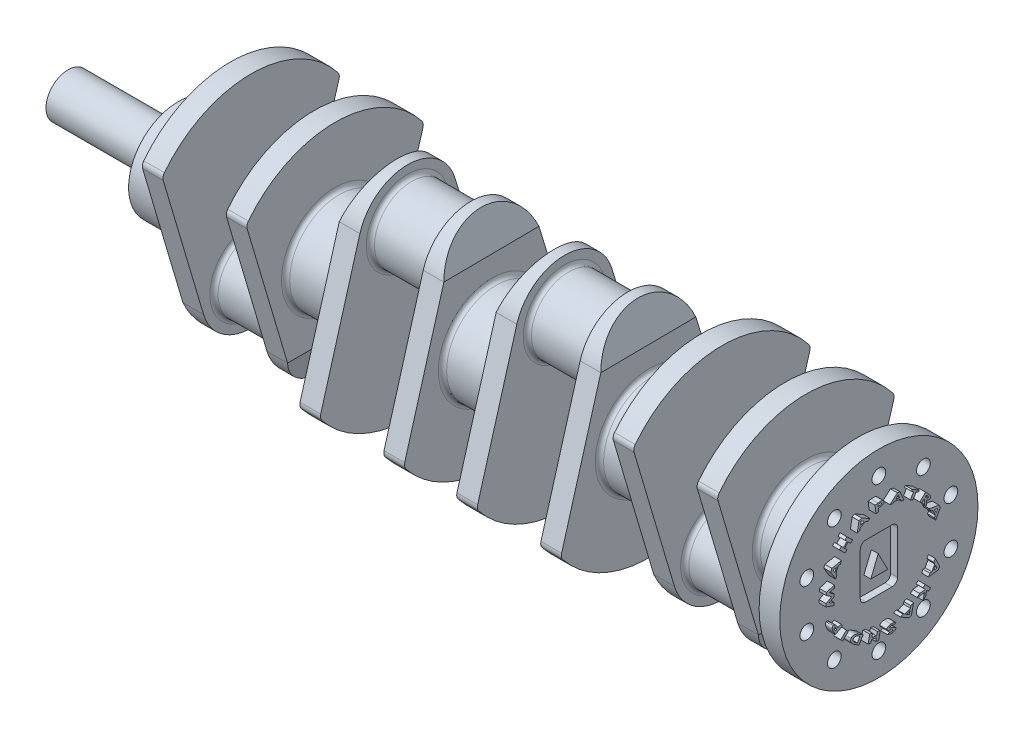
from build123d import *

# Parameters (mm, degrees)
SKETCH1_R               = 36
BOSS_EXTRUDE1_DEPTH     = 38
SKETCH3_R               = 27
BOSS_EXTRUDE2_DEPTH     = 15
SKETCH3_2_R             = 27
BOSS_EXTRUDE3_DEPTH     = 61
CUT_EXTRUDE1_DEPTH      = 143.724458813
CUT_EXTRUDE1_DEPTH_BACK = 143.724458813
BODY_MOVE_COPY1_ANGLE   = 179.5
BOSS_EXTRUDE4_START     = 15
SKETCH5_R               = 72
SKETCH5_R_2             = 5
SKETCH5_R_3             = 36
BOSS_EXTRUDE4_DEPTH     = 15
SKETCH6_R               = 16
BOSS_EXTRUDE5_DEPTH     = 80
FILLET1_R               = 3
FILLET2_R               = 5
WRAP1_DEPTH             = 5
WRAP2_START             = -5
WRAP2_DEPTH             = 5


# Read off the part's stored shape, not the designer's step: Wrap1, Wrap2
with BuildPart() as part:
    # Sketch1 → Boss-Extrude1 (new body)
    with BuildSketch(Plane(origin=(0, 0, 0), x_dir=(0, 0, -1), z_dir=(1, 0, 0))):
        Circle(SKETCH1_R)
    extrude(amount=BOSS_EXTRUDE1_DEPTH)

    # Sketch3 → Boss-Extrude2 (add)
    with BuildSketch(Plane(origin=(38, 0, 0), x_dir=(0, 0, -1), z_dir=(1, 0, 0))):
        with BuildLine():
            Line((-34.517510455, -54.224552409), (-64.569893475, 47.23059238))
            ThreePointArc((-64.569893475, 47.23059238), (0, 80), (64.569893475, 47.23059238))
            Line((64.569893475, 47.23059238), (34.517510455, -54.224552409))
            ThreePointArc((34.517510455, -54.224552409), (0, -80), (-34.517510455, -54.224552409))
        make_face()
        with Locations(Location((0, -44, 0), (0, 0, 144.817798311))):
            Circle(SKETCH3_R, mode=Mode.SUBTRACT)
    extrude(amount=BOSS_EXTRUDE2_DEPTH)

    # Sketch3<2> → Boss-Extrude3 (add)
    with BuildSketch(Plane(origin=(38, 0, 0), x_dir=(0, 0, -1), z_dir=(1, 0, 0))):
        with Locations(Location((0, -44, 0), (0, 0, 180))):
            Circle(SKETCH3_2_R)
    extrude(amount=BOSS_EXTRUDE3_DEPTH)

    # Sketch4 → Cut-Extrude1 (cut, two sides: drawn at the far end of the back side and taken through both)
    with BuildSketch(Plane.XY.offset(-CUT_EXTRUDE1_DEPTH_BACK)):
        Polygon((38, -54.224552409), (45.5, -80), (38, -80), align=None)
    extrude(amount=CUT_EXTRUDE1_DEPTH + CUT_EXTRUDE1_DEPTH_BACK, mode=Mode.SUBTRACT)

    # Mirror3: part across plane


with BuildPart() as part_1:
    add(part.part)
    add(part.part.mirror(Plane(origin=(76, 0, 0), x_dir=(0, 0, 1), z_dir=(1, 0, 0))))


with BuildPart() as body_2:
    # Mirror4: mirrored copy
    add(part_1.part.mirror(Plane(origin=(133, 0, 0), x_dir=(0, 0, 1), z_dir=(1, 0, 0))))


with BuildPart() as body_2_1:
    # Body-Move/Copy1: moved
    add(body_2.part.rotate(Axis((0, 0, 0), (-1, 0, 0)), BODY_MOVE_COPY1_ANGLE))


with BuildPart() as part_2:
    add(part_1.part)

    # Combine1: union body 2
    add(body_2_1.part)

    # Mirror5: part across plane


with BuildPart() as part_3:
    add(part_2.part)
    add(part_2.part.mirror(Plane(origin=(247, 0, 0), x_dir=(0, 0, 1), z_dir=(1, 0, 0))))

    # Sketch5 → Boss-Extrude4 (add)
    # profile 1 of 2: a face of its own
    with BuildSketch(Plane(origin=(494, 0, 0), x_dir=(0, 0, -1), z_dir=(1, 0, 0)).offset(BOSS_EXTRUDE4_START)):
        Circle(SKETCH5_R)
        with Locations((-32.328188876, 44.495934691)):
            Circle(SKETCH5_R_2, mode=Mode.SUBTRACT)
        with Locations((-52.308108396, 16.995934691)):
            Circle(SKETCH5_R_2, mode=Mode.SUBTRACT)
        with Locations((-52.308108396, -16.995934691)):
            Circle(SKETCH5_R_2, mode=Mode.SUBTRACT)
        with Locations((-32.328188876, -44.495934691)):
            Circle(SKETCH5_R_2, mode=Mode.SUBTRACT)
        with Locations((0, -55)):
            Circle(SKETCH5_R_2, mode=Mode.SUBTRACT)
        with Locations((32.328188876, -44.495934691)):
            Circle(SKETCH5_R_2, mode=Mode.SUBTRACT)
        with Locations((52.308108396, -16.995934691)):
            Circle(SKETCH5_R_2, mode=Mode.SUBTRACT)
        with Locations((52.308108396, 16.995934691)):
            Circle(SKETCH5_R_2, mode=Mode.SUBTRACT)
        with Locations((32.328188876, 44.495934691)):
            Circle(SKETCH5_R_2, mode=Mode.SUBTRACT)
        with Locations((0, 55)):
            Circle(SKETCH5_R_2, mode=Mode.SUBTRACT)
        Circle(SKETCH5_R_3, mode=Mode.SUBTRACT)
    # profile 2 of 2: a face of its own
    with BuildSketch(Plane(origin=(494, 0, 0), x_dir=(0, 0, -1), z_dir=(1, 0, 0)).offset(BOSS_EXTRUDE4_START)):
        Circle(SKETCH5_R_3)
    extrude(amount=-BOSS_EXTRUDE4_DEPTH)

    # Sketch6 → Boss-Extrude5 (add)
    with BuildSketch(Plane.ZY):
        Circle(SKETCH6_R)
    extrude(amount=BOSS_EXTRUDE5_DEPTH)

    # Fillet1
    fillet1_edges = [part_3.edges().sort_by_distance(p)[0] for p in [
        (53, -44, -27),
        (456, 0, 36),
        (494, 0, 36),
        (441, -44, -27),
        (395, -44, -27),
        (342, 0, 36),
        (380, 0, 36),
        (281, 43.762708156, 27.382939485),
        (327, 43.762708156, 27.382939485),
        (0, 0, -16),
        (99, -44, -27),
        (38, 0, 36),
        (114, 0, 36),
        (152, 0, 36),
        (228, 0.314155278, -35.99862923),
        (266, 0.314155278, -35.99862923),
        (213, 43.762708156, 27.382939485),
        (167, 43.762708156, 27.382939485),
    ]]
    fillet(fillet1_edges, radius=FILLET1_R)

    # Fillet2
    fillet2_edges = [part_3.edges().sort_by_distance(p)[0] for p in [
        (45.5, 47.23059238, 64.569893475),
        (448.5, 47.23059238, -64.569893475),
        (448.5, 47.23059238, 64.569893475),
        (387.5, 47.23059238, -64.569893475),
        (387.5, 47.23059238, 64.569893475),
        (273.5, -47.792265452, 64.155275411),
        (273.5, -46.665322516, -64.979594293),
        (334.5, -47.792265452, 64.155275411),
        (334.5, -46.665322516, -64.979594293),
        (106.5, 47.23059238, -64.569893475),
        (106.5, 47.23059238, 64.569893475),
        (220.5, -47.792265452, 64.155275411),
        (220.5, -46.665322516, -64.979594293),
        (159.5, -47.792265452, 64.155275411),
        (159.5, -46.665322516, -64.979594293),
        (45.5, 47.23059238, -64.569893475),
    ]]
    fillet(fillet2_edges, radius=FILLET2_R)

    # Wrap1 outline → Wrap1 (add)
    # profile 1 of 17: a face of its own
    with BuildSketch(Plane(origin=(509, 0, 0), x_dir=(0, 0, -1), z_dir=(1, 0, 0))):
        with BuildLine():
            add(Edge.make_bspline(
                [(30.429145669, 31.278633196), (30.529714484, 31.175524895), (30.723586774, 30.97675709), (30.998471286, 30.685651702), (31.247338782, 30.41362089), (31.470231429, 30.161696818), (31.665061076, 29.927807723), (31.835209086, 29.715007837), (31.977848594, 29.52002756), (32.09739194, 29.341520557), (32.195364999, 29.171832525), (32.282688438, 29.009274234), (32.355863107, 28.847193799), (32.419966671, 28.687840548), (32.469403122, 28.528430808), (32.510142867, 28.371486623), (32.536172291, 28.215731032), (32.553469658, 28.063541172), (32.55684607, 27.91529612), (32.548408891, 27.773035329), (32.524589617, 27.637930635), (32.488880662, 27.509728828), (32.438023848, 27.389132553), (32.37520509, 27.275109299), (32.297221124, 27.16917764), (32.236800833, 27.105186363), (32.206178923, 27.072754623)],
                knots=[0, 0, 0, 0, 0.086183646, 0.166141174, 0.239561119, 0.306794224, 0.367392138, 0.421693658, 0.469793409, 0.511914684, 0.5501677, 0.58699646, 0.622277761, 0.656525956, 0.689699113, 0.722076818, 0.753468047, 0.784108508, 0.813653429, 0.842088185, 0.869235459, 0.895591144, 0.921549795, 0.947369509, 0.973326077, 1, 1, 1, 1], degree=3))
            Line((30.429145669, 31.278633196), (28.898145235, 32.836452373))
            Line((28.898145235, 32.836452373), (24.770390828, 28.78099197))
            Line((24.770390828, 28.78099197), (26.213938839, 27.311791248))
            Line((26.213938839, 27.311791248), (27.961821284, 29.029356853))
            Line((27.961821284, 29.029356853), (28.095915, 28.892931072))
            Line((28.095915, 28.892931072), (28.055103869, 25.439143345))
            Line((28.055103869, 25.439143345), (29.632745596, 23.833516843))
            Line((29.632745596, 23.833516843), (29.673556727, 27.46337545))
            add(Edge.make_bspline(
                [(32.206178923, 27.072754623), (32.171961657, 27.041121702), (32.104221329, 26.97849763), (31.990451903, 26.901801135), (31.869962485, 26.840696535), (31.743165908, 26.79307029), (31.608554693, 26.763003301), (31.466866723, 26.749837996), (31.318767717, 26.749263935), (31.163509451, 26.766904468), (31.001494792, 26.798121919), (30.832517724, 26.847024585), (30.656742721, 26.911613183), (30.473476864, 26.991243783), (30.283170427, 27.086515942), (30.08501184, 27.195703857), (29.880398297, 27.322481134), (29.743945745, 27.415428548), (29.673556727, 27.46337545)],
                knots=[0, 0, 0, 0, 0.050124638, 0.099232343, 0.14715377, 0.195359514, 0.244709218, 0.295187372, 0.348344958, 0.403905245, 0.463173033, 0.525841674, 0.593106823, 0.664720363, 0.740905851, 0.822215008, 0.908289653, 1, 1, 1, 1], degree=3))
        make_face()
        with BuildLine():
            add(Edge.make_bspline(
                [(29.182657121, 29.319698901), (29.238412559, 29.263513059), (29.345092754, 29.156009347), (29.501859082, 29.004855542), (29.648088289, 28.870671225), (29.785249965, 28.754042322), (29.910196652, 28.651940565), (30.026020716, 28.567823102), (30.130415707, 28.499153161), (30.226555787, 28.447933205), (30.315355525, 28.410286306), (30.399698109, 28.387035496), (30.479615524, 28.374216182), (30.555620577, 28.3756137), (30.628043002, 28.388044977), (30.696050095, 28.414438721), (30.760670545, 28.451843357), (30.797433269, 28.485984366), (30.816268399, 28.503476278)],
                knots=[0, 0, 0, 0, 0.11871841, 0.227150992, 0.326598645, 0.416323744, 0.497170778, 0.568533097, 0.630950928, 0.684412112, 0.731721949, 0.775284498, 0.8153523, 0.852666451, 0.888800719, 0.924963191, 0.961555406, 1, 1, 1, 1], degree=3))
            Line((29.182657121, 29.319698901), (28.727904517, 29.781447699))
            Line((28.727904517, 29.781447699), (29.572111915, 30.611662709))
            Line((29.572111915, 30.611662709), (29.968562904, 30.208215527))
            add(Edge.make_bspline(
                [(30.816268399, 28.503476278), (30.836700296, 28.526640455), (30.877740004, 28.573168249), (30.914707454, 28.661305922), (30.931124018, 28.760164094), (30.924532334, 28.868789509), (30.901054465, 28.985355536), (30.857967242, 29.10678091), (30.797799835, 29.232625813), (30.731975951, 29.339354876), (30.6684681, 29.433178212), (30.604002347, 29.512772859), (30.530345492, 29.60522887), (30.442411303, 29.706354153), (30.341799628, 29.817241255), (30.228557933, 29.938032555), (30.103829801, 30.070585617), (30.014996402, 30.16097087), (29.968562904, 30.208215527)],
                knots=[0, 0, 0, 0, 0.044650945, 0.089686329, 0.136688453, 0.189283969, 0.246905011, 0.30908811, 0.376061549, 0.449318408, 0.491164293, 0.540670563, 0.598116814, 0.663018007, 0.735422287, 0.815776509, 0.9037058, 1, 1, 1, 1], degree=3))
        make_face(mode=Mode.SUBTRACT)
    # profile 2 of 17: a face of its own
    with BuildSketch(Plane(origin=(509, 0, 0), x_dir=(0, 0, -1), z_dir=(1, 0, 0))):
        with BuildLine():
            add(Edge.make_bspline(
                [(-5.622220222, 43.296977633), (-5.480400337, 43.312592244), (-5.206677104, 43.342729638), (-4.810936692, 43.378860622), (-4.445112894, 43.405660973), (-4.109669055, 43.425115991), (-3.8040552, 43.434317908), (-3.528746531, 43.436338864), (-3.283637265, 43.42882642), (-3.065315646, 43.411467215), (-2.86672486, 43.384619422), (-2.680272938, 43.353393101), (-2.503944058, 43.310402051), (-2.336845204, 43.262493672), (-2.180042362, 43.204261582), (-2.031355707, 43.141492745), (-1.893810958, 43.066987109), (-1.765300678, 42.987381996), (-1.648744829, 42.899865775), (-1.543982804, 42.806742157), (-1.453404254, 42.705962781), (-1.377516566, 42.597896413), (-1.31382102, 42.484484312), (-1.264464273, 42.364337649), (-1.229021656, 42.237438112), (-1.216374339, 42.149788123), (-1.209953929, 42.105292603)],
                knots=[0, 0, 0, 0, 0.085263731, 0.164565526, 0.237464279, 0.304463238, 0.3653482, 0.420166087, 0.468971369, 0.511852137, 0.550977558, 0.588706681, 0.624763539, 0.659382178, 0.692523, 0.724669681, 0.755740161, 0.785901322, 0.814935959, 0.842732648, 0.869545314, 0.895710275, 0.921497217, 0.947119392, 0.973155158, 1, 1, 1, 1], degree=3))
            Line((-5.622220222, 43.296977633), (-7.798036528, 43.053276878))
            Line((-7.798036528, 43.053276878), (-7.15555272, 37.317563904))
            Line((-7.15555272, 37.317563904), (-5.104501872, 37.547272271))
            Line((-5.104501872, 37.547272271), (-5.377353435, 39.97611759))
            add(Edge.make_bspline(
                [(-3.226023807, 40.308436801), (-3.279558015, 40.294771483), (-3.396547762, 40.264908294), (-3.589083268, 40.226859362), (-3.812043643, 40.185482526), (-4.066113743, 40.145593177), (-4.350636096, 40.103624517), (-4.665426864, 40.060431791), (-5.010985976, 40.017293707), (-5.251779336, 39.99023089), (-5.377353435, 39.97611759)],
                knots=[0, 0, 0, 0, 0.076079011, 0.166257513, 0.270200311, 0.388387942, 0.52041265, 0.666291712, 0.825970627, 1, 1, 1, 1], degree=3))
            add(Edge.make_bspline(
                [(-1.209953929, 42.105292603), (-1.206300346, 42.055950966), (-1.199100534, 41.958717503), (-1.211319953, 41.813395423), (-1.243098574, 41.672682688), (-1.293800521, 41.536279302), (-1.363582145, 41.404227975), (-1.453054451, 41.277102347), (-1.561157055, 41.153776013), (-1.689059968, 41.037062105), (-1.831919809, 40.924172382), (-1.990114637, 40.818613509), (-2.161106307, 40.717592016), (-2.346791019, 40.62369052), (-2.546479501, 40.535068163), (-2.760248551, 40.452649595), (-2.987566383, 40.375079451), (-3.145333203, 40.330987727), (-3.226023807, 40.308436801)],
                knots=[0, 0, 0, 0, 0.050511539, 0.099538891, 0.148405011, 0.197554546, 0.247846877, 0.300638037, 0.356100292, 0.415136975, 0.477370203, 0.542050923, 0.609369429, 0.680262357, 0.754605722, 0.832589137, 0.914376903, 1, 1, 1, 1], degree=3))
        make_face()
        with BuildLine():
            add(Edge.make_bspline(
                [(-4.844476665, 41.114165133), (-4.783069442, 41.12157563), (-4.66489817, 41.135836297), (-4.494823779, 41.15594357), (-4.339818351, 41.178434731), (-4.199463228, 41.200445255), (-4.073900252, 41.222559957), (-3.962813041, 41.243927313), (-3.86745717, 41.267786799), (-3.761296366, 41.295986876), (-3.64692827, 41.338154972), (-3.524266088, 41.394408491), (-3.419145516, 41.460199428), (-3.331369841, 41.532975402), (-3.261755654, 41.612447999), (-3.214928194, 41.698737246), (-3.191178295, 41.790778376), (-3.193412214, 41.852540334), (-3.194540935, 41.883746463)],
                knots=[0, 0, 0, 0, 0.093628204, 0.180176914, 0.259221216, 0.330702091, 0.395219142, 0.452218799, 0.501877336, 0.543984089, 0.618427735, 0.686066927, 0.747932726, 0.805560497, 0.858144179, 0.906838381, 0.952928734, 1, 1, 1, 1], degree=3))
            Line((-4.844476665, 41.114165133), (-5.496288731, 41.040705097))
            Line((-5.496288731, 41.040705097), (-5.628050383, 42.213733609))
            Line((-5.628050383, 42.213733609), (-5.049698353, 42.279031419))
            add(Edge.make_bspline(
                [(-3.733247866, 42.312846356), (-3.766610864, 42.318419365), (-3.839219596, 42.330548046), (-3.958188721, 42.338214739), (-4.09505456, 42.343248753), (-4.250263839, 42.341493053), (-4.424056137, 42.334295124), (-4.616496058, 42.321250782), (-4.827133079, 42.302308516), (-4.973536872, 42.286996804), (-5.049698353, 42.279031419)],
                knots=[0, 0, 0, 0, 0.076795943, 0.167132944, 0.270497902, 0.38793295, 0.519598425, 0.665607792, 0.826044084, 1, 1, 1, 1], degree=3))
            add(Edge.make_bspline(
                [(-3.194540935, 41.883746463), (-3.198826595, 41.910485214), (-3.207286662, 41.963268594), (-3.240068496, 42.036635573), (-3.286717412, 42.102102904), (-3.347645678, 42.160183568), (-3.423673513, 42.210270246), (-3.513971504, 42.253100692), (-3.618685583, 42.287853279), (-3.693807703, 42.304242032), (-3.733247866, 42.312846356)],
                knots=[0, 0, 0, 0, 0.10925285, 0.215669566, 0.321771664, 0.433068059, 0.554402804, 0.688837443, 0.836635309, 1, 1, 1, 1], degree=3))
        make_face(mode=Mode.SUBTRACT)
    # profile 3 of 17: a face of its own
    with BuildSketch(Plane(origin=(509, 0, 0), x_dir=(0, 0, -1), z_dir=(1, 0, 0))):
        with BuildLine():
            add(Edge.make_bspline(
                [(-37.6596163, -22.112060764), (-37.729142009, -21.987483758), (-37.863159205, -21.747350127), (-38.051321694, -21.3973175), (-38.218808858, -21.071333799), (-38.367938928, -20.770146189), (-38.49606757, -20.492854973), (-38.605553252, -20.240256195), (-38.692923128, -20.011193031), (-38.764028601, -19.804272258), (-38.817000007, -19.611197005), (-38.85944948, -19.427704374), (-38.889915143, -19.249354534), (-38.909793846, -19.0769213), (-38.919815247, -18.90987164), (-38.917129491, -18.748592087), (-38.90500097, -18.592985072), (-38.880141999, -18.443764972), (-38.846122014, -18.301789681), (-38.799589048, -18.169117543), (-38.740258062, -18.046988849), (-38.672351789, -17.933622358), (-38.59176824, -17.830938675), (-38.500522371, -17.738295281), (-38.397231175, -17.656099002), (-38.321668982, -17.61000657), (-38.28344359, -17.586689336)],
                knots=[0, 0, 0, 0, 0.085281514, 0.164387959, 0.237543378, 0.304357025, 0.365275386, 0.420129158, 0.468888674, 0.511797458, 0.550862296, 0.588513439, 0.624342608, 0.658955573, 0.692232668, 0.724299458, 0.755306674, 0.785444252, 0.814634604, 0.842485815, 0.869297104, 0.89567604, 0.921331871, 0.947126202, 0.97325221, 1, 1, 1, 1], degree=3))
            Line((-37.6596163, -22.112060764), (-36.586866567, -24.01619154))
            Line((-36.586866567, -24.01619154), (-31.548440919, -21.176902844))
            Line((-31.548440919, -21.176902844), (-32.560556971, -19.381213074))
            Line((-32.560556971, -19.381213074), (-34.694396114, -20.583392394))
            add(Edge.make_bspline(
                [(-35.839439851, -18.736397202), (-35.806096198, -18.780483845), (-35.733334243, -18.876688975), (-35.622156202, -19.038254999), (-35.497747142, -19.226785002), (-35.360672871, -19.44356896), (-35.212614477, -19.689192572), (-35.050245972, -19.96227076), (-34.875271666, -20.262866532), (-34.756330253, -20.473640174), (-34.694396114, -20.583392394)],
                knots=[0, 0, 0, 0, 0.076248107, 0.166387334, 0.270489101, 0.387859604, 0.520188358, 0.666126712, 0.826148401, 1, 1, 1, 1], degree=3))
            add(Edge.make_bspline(
                [(-38.28344359, -17.586689336), (-38.239279681, -17.564079795), (-38.152059664, -17.519427848), (-38.013228165, -17.47452152), (-37.871535937, -17.446646318), (-37.725836973, -17.439931377), (-37.576707549, -17.453586496), (-37.424298836, -17.485015423), (-37.269310157, -17.537973935), (-37.111275988, -17.607774369), (-36.952034961, -17.695846275), (-36.792081689, -17.798860909), (-36.631737008, -17.916938784), (-36.472852017, -18.051757577), (-36.312041614, -18.19952693), (-36.154620686, -18.365371791), (-35.993489804, -18.54292301), (-35.891596991, -18.670892082), (-35.839439851, -18.736397202)],
                knots=[0, 0, 0, 0, 0.050632458, 0.09999486, 0.148525686, 0.197835325, 0.248467783, 0.301204873, 0.356470488, 0.415512229, 0.477548236, 0.54222254, 0.60982719, 0.680872694, 0.75507247, 0.832882904, 0.914455694, 1, 1, 1, 1], degree=3))
        make_face()
        with BuildLine():
            add(Edge.make_bspline(
                [(-35.950212921, -20.540249199), (-35.980772721, -20.4861404), (-36.039262614, -20.38257893), (-36.125791522, -20.234762413), (-36.207908649, -20.101437836), (-36.281312061, -19.979676571), (-36.351683206, -19.873626931), (-36.415971942, -19.781197832), (-36.47375888, -19.701854257), (-36.542207768, -19.616078555), (-36.625930831, -19.527514708), (-36.725416408, -19.436015575), (-36.82773037, -19.365612006), (-36.928814375, -19.313041247), (-37.02876529, -19.281944383), (-37.125695483, -19.271040862), (-37.219728843, -19.284797691), (-37.275739848, -19.311687617), (-37.303976443, -19.325243523)],
                knots=[0, 0, 0, 0, 0.094145789, 0.18019022, 0.25946636, 0.331373404, 0.395557877, 0.45224046, 0.501941496, 0.544244423, 0.618401923, 0.686375025, 0.748606577, 0.80601552, 0.858356821, 0.906285607, 0.952756154, 1, 1, 1, 1], degree=3))
            Line((-35.950212921, -20.540249199), (-35.629554033, -21.110439002))
            Line((-35.629554033, -21.110439002), (-36.660326603, -21.691123097))
            Line((-36.660326603, -21.691123097), (-36.944838489, -21.185065071))
            add(Edge.make_bspline(
                [(-37.489375581, -19.98754988), (-37.481709477, -20.020336808), (-37.464999894, -20.091801521), (-37.426337088, -20.204790645), (-37.376060916, -20.332562743), (-37.313884848, -20.474755365), (-37.240049736, -20.632052951), (-37.152437079, -20.803441095), (-37.053430089, -20.990097393), (-36.982001205, -21.118342337), (-36.944838489, -21.185065071)],
                knots=[0, 0, 0, 0, 0.076522088, 0.166792964, 0.271172315, 0.388728042, 0.519589831, 0.666225044, 0.826344985, 1, 1, 1, 1], degree=3))
            add(Edge.make_bspline(
                [(-37.303976443, -19.325243523), (-37.326941597, -19.339390127), (-37.372254576, -19.367303058), (-37.425834394, -19.426688848), (-37.46960177, -19.494321271), (-37.497710037, -19.573825258), (-37.515609257, -19.662906253), (-37.519327544, -19.76226064), (-37.510582485, -19.872019951), (-37.496705038, -19.947620827), (-37.489375581, -19.98754988)],
                knots=[0, 0, 0, 0, 0.108860319, 0.214794341, 0.321056187, 0.433773539, 0.554329405, 0.68845439, 0.835455331, 1, 1, 1, 1], degree=3))
        make_face(mode=Mode.SUBTRACT)
    # profile 4 of 17: a face of its own
    with BuildSketch(Plane(origin=(509, 0, 0), x_dir=(0, 0, -1), z_dir=(1, 0, 0))):
        with BuildLine():
            add(Edge.make_bspline(
                [(-21.561806926, -37.865119371), (-21.64431798, -37.813990965), (-21.806295318, -37.713620861), (-22.043533488, -37.562414882), (-22.272021808, -37.415396561), (-22.489458779, -37.268323213), (-22.700398417, -37.128735099), (-22.899184734, -36.987554836), (-23.090400895, -36.852181365), (-23.271615083, -36.718420197), (-23.444120558, -36.588705679), (-23.6060531, -36.460082544), (-23.758906928, -36.334950424), (-23.903782283, -36.214499387), (-24.038101314, -36.095259351), (-24.162594345, -35.978288561), (-24.279353505, -35.866067769), (-24.420191376, -35.720185143), (-24.582286171, -35.537945469), (-24.759729084, -35.31401759), (-24.919760636, -35.086033128), (-25.063789909, -34.855205853), (-25.189978882, -34.620355409), (-25.299242743, -34.381797211), (-25.389692476, -34.138722046), (-25.464985574, -33.894253275), (-25.5187656, -33.650242248), (-25.550182599, -33.410253443), (-25.555508477, -33.176246405), (-25.539924592, -32.947984148), (-25.499313491, -32.725605378), (-25.432169603, -32.509876706), (-25.346333131, -32.298212847), (-25.26911768, -32.165881417), (-25.230144599, -32.099089557)],
                knots=[0, 0, 0, 0, 0.038475521, 0.075531242, 0.111512892, 0.146166871, 0.179581902, 0.211766711, 0.242804186, 0.272447562, 0.301042266, 0.328351756, 0.354411043, 0.379344812, 0.403027242, 0.425590776, 0.447054505, 0.467211112, 0.505952528, 0.543680493, 0.580396447, 0.616308104, 0.651462248, 0.68600337, 0.72022797, 0.754198136, 0.787318856, 0.819155159, 0.849977758, 0.879944067, 0.909708904, 0.939340667, 0.969383315, 1, 1, 1, 1], degree=3))
            Line((-21.561806926, -37.865119371), (-19.480439237, -39.150086986))
            Line((-19.480439237, -39.150086986), (-16.434762822, -34.218936311))
            Line((-16.434762822, -34.218936311), (-18.547613383, -32.914146147))
            add(Edge.make_bspline(
                [(-25.230144599, -32.099089557), (-25.200265984, -32.052638175), (-25.140747522, -31.960106616), (-25.03738554, -31.83263907), (-24.926214697, -31.71338254), (-24.804448831, -31.605542959), (-24.674963684, -31.505533309), (-24.535249952, -31.416952355), (-24.386730603, -31.337525572), (-24.229366072, -31.267544837), (-24.064298474, -31.208638117), (-23.893560476, -31.159862314), (-23.71812174, -31.119847388), (-23.537076947, -31.090413281), (-23.350412596, -31.073744945), (-23.158592321, -31.065662745), (-22.961607007, -31.066195976), (-22.691940259, -31.08463763), (-22.351802784, -31.127543172), (-21.944108552, -31.210140549), (-21.539614433, -31.327984495), (-21.238324824, -31.43824664), (-21.035124176, -31.525235816), (-20.923210632, -31.575470138), (-20.803400813, -31.631267946), (-20.675801002, -31.693273275), (-20.541055815, -31.761973426), (-20.398394137, -31.837315425), (-20.247397264, -31.916706305), (-20.08948154, -32.004225785), (-19.922774664, -32.095405496), (-19.749401393, -32.19480815), (-19.568327207, -32.300500272), (-19.378372359, -32.409880353), (-19.182786404, -32.529352425), (-18.977071115, -32.650446971), (-18.765163523, -32.780654344), (-18.621077617, -32.869067467), (-18.547613383, -32.914146147)],
                knots=[0, 0, 0, 0, 0.022205579, 0.044233707, 0.065916113, 0.087732869, 0.109594972, 0.131674658, 0.154201662, 0.177303159, 0.2008969, 0.224653314, 0.248704342, 0.27325547, 0.29838493, 0.324053524, 0.350481098, 0.377588334, 0.432749826, 0.48828882, 0.544758688, 0.602099999, 0.617232715, 0.633681684, 0.65145124, 0.670404062, 0.69075485, 0.712298093, 0.73531263, 0.759386523, 0.784933368, 0.811757681, 0.839785194, 0.869287189, 0.899939973, 0.931987373, 0.965322802, 1, 1, 1, 1], degree=3))
        make_face()
        with BuildLine():
            add(Edge.make_bspline(
                [(-19.566725629, -33.55429789), (-19.663666815, -33.494839391), (-19.850735964, -33.380101256), (-20.124840393, -33.220369408), (-20.381235172, -33.077707743), (-20.620024435, -32.953026662), (-20.840512999, -32.844859384), (-21.043751509, -32.755138956), (-21.228258607, -32.6804912), (-21.39877483, -32.624739975), (-21.558726467, -32.581640551), (-21.713846076, -32.55056676), (-21.866322405, -32.527608397), (-22.016727189, -32.51606557), (-22.165188948, -32.514644613), (-22.311231836, -32.524372156), (-22.455110518, -32.542622892), (-22.59583814, -32.571809175), (-22.732024854, -32.610616385), (-22.860983647, -32.662125604), (-22.982013755, -32.725591781), (-23.095569114, -32.800712219), (-23.202564215, -32.887059334), (-23.299995809, -32.986885859), (-23.390977417, -33.097043484), (-23.443746629, -33.177523072), (-23.470601831, -33.218480582)],
                knots=[0, 0, 0, 0, 0.077761743, 0.150058232, 0.216918162, 0.278377842, 0.334244975, 0.384816171, 0.430271195, 0.47027762, 0.507411471, 0.543480977, 0.578399183, 0.6127874, 0.646542247, 0.679832461, 0.712798571, 0.74563694, 0.778019342, 0.80950702, 0.840416208, 0.871302534, 0.902475694, 0.934236993, 0.966532022, 1, 1, 1, 1], degree=3))
            Line((-19.566725629, -33.55429789), (-18.751669038, -34.058023851))
            Line((-18.751669038, -34.058023851), (-20.670958234, -37.16549998))
            Line((-20.670958234, -37.16549998), (-21.266800749, -36.797033767))
            add(Edge.make_bspline(
                [(-23.401805924, -34.940710316), (-23.379995137, -34.976299223), (-23.3351374, -35.049494094), (-23.259565979, -35.157602317), (-23.173341333, -35.265803212), (-23.080924418, -35.377025333), (-22.977142002, -35.487301473), (-22.866775413, -35.600882967), (-22.746397532, -35.7150276), (-22.616921744, -35.830070987), (-22.479186323, -35.94706112), (-22.33225611, -36.064433003), (-22.176567435, -36.18351938), (-22.012879082, -36.305096287), (-21.838324563, -36.425491593), (-21.657071615, -36.549900979), (-21.465029177, -36.673116681), (-21.33373619, -36.755190905), (-21.266800749, -36.797033767)],
                knots=[0, 0, 0, 0, 0.043879701, 0.090246356, 0.138560192, 0.189313178, 0.242231077, 0.297713932, 0.355812362, 0.416592433, 0.479799539, 0.545789492, 0.614282789, 0.685880143, 0.760133794, 0.837206952, 0.917005281, 1, 1, 1, 1], degree=3))
            add(Edge.make_bspline(
                [(-23.470601831, -33.218480582), (-23.507724623, -33.283543299), (-23.580678018, -33.411403994), (-23.651918055, -33.617984632), (-23.694908694, -33.828223173), (-23.700580096, -34.043554162), (-23.675752306, -34.263407437), (-23.616980523, -34.487355209), (-23.526764761, -34.716560021), (-23.444428129, -34.864254901), (-23.401805924, -34.940710316)],
                knots=[0, 0, 0, 0, 0.123182135, 0.242076482, 0.358249215, 0.475504185, 0.595374134, 0.721650234, 0.855910056, 1, 1, 1, 1], degree=3))
        make_face(mode=Mode.SUBTRACT)
    # profile 5 of 17: a face of its own
    with BuildSketch(Plane(origin=(509, 0, 0), x_dir=(0, 0, -1), z_dir=(1, 0, 0))):
        with BuildLine():
            add(Edge.make_bspline(
                [(2.750963939, -42.105921218), (2.821962944, -42.146535427), (2.960895025, -42.226010014), (3.174397596, -42.326723387), (3.387078997, -42.40892957), (3.599229571, -42.472038905), (3.810256128, -42.516476894), (4.019922398, -42.544106609), (4.229306192, -42.551703598), (4.36790583, -42.541351379), (4.437046671, -42.536187143)],
                knots=[0, 0, 0, 0, 0.138559973, 0.271136551, 0.399564926, 0.524597876, 0.645761688, 0.764623122, 0.882581545, 1, 1, 1, 1], degree=3))
            Line((2.750963939, -42.105921218), (1.306249896, -42.971117198))
            add(Edge.make_bspline(
                [(4.510506707, -43.583284165), (4.377667769, -43.593888053), (4.114224691, -43.614917435), (3.721077408, -43.616986973), (3.335061527, -43.592334463), (3.017829671, -43.550723728), (2.764361224, -43.502726234), (2.570400386, -43.45571538), (2.3711083, -43.399748659), (2.167844377, -43.33245497), (1.958207035, -43.258796093), (1.745142695, -43.171141303), (1.526170216, -43.076526773), (1.380262091, -43.006591837), (1.306249896, -42.971117198)],
                knots=[0, 0, 0, 0, 0.120763213, 0.239494784, 0.355993244, 0.471143555, 0.529253843, 0.589754305, 0.651989177, 0.716831998, 0.783805763, 0.853350778, 0.925611883, 1, 1, 1, 1], degree=3))
            add(Edge.make_bspline(
                [(7.325308724, -41.838899817), (7.327599398, -41.8883383), (7.332161495, -41.986799746), (7.304776221, -42.134636832), (7.249391529, -42.278100367), (7.169012227, -42.420331399), (7.058655511, -42.557183184), (6.92296498, -42.692387783), (6.759555545, -42.823486442), (6.571934532, -42.951484482), (6.36433964, -43.072475165), (6.14018527, -43.18245067), (5.90254799, -43.280120431), (5.650781552, -43.365116322), (5.385629447, -43.438406948), (5.106643258, -43.50020785), (4.813504524, -43.549224103), (4.612851565, -43.571779554), (4.510506707, -43.583284165)],
                knots=[0, 0, 0, 0, 0.041256494, 0.082166235, 0.124520739, 0.169325696, 0.218131309, 0.270962205, 0.329153765, 0.392946586, 0.460639787, 0.529791942, 0.601458201, 0.675215723, 0.751742568, 0.831266396, 0.913935898, 1, 1, 1, 1], degree=3))
            add(Edge.make_bspline(
                [(4.341432021, -40.107341824), (4.416097745, -40.131317893), (4.562500345, -40.17832954), (4.777043297, -40.249505175), (4.981472426, -40.319145672), (5.175654415, -40.38723692), (5.360107405, -40.452311552), (5.534815757, -40.51598269), (5.6986598, -40.579668581), (5.853737784, -40.638357207), (5.997542902, -40.698096358), (6.131936192, -40.755442903), (6.256801068, -40.809597787), (6.370803924, -40.863496404), (6.475264732, -40.914672035), (6.569232708, -40.964689773), (6.653899101, -41.01244102), (6.751244644, -41.073376158), (6.858974473, -41.14944903), (6.973936688, -41.242540301), (7.072959482, -41.337452005), (7.156203399, -41.434003708), (7.223567083, -41.532381701), (7.274699896, -41.632499913), (7.309500045, -41.734760025), (7.320083241, -41.804476908), (7.325308724, -41.838899817)],
                knots=[0, 0, 0, 0, 0.065545193, 0.1285193, 0.188926449, 0.246050725, 0.300507776, 0.352409746, 0.401459837, 0.447431183, 0.490988345, 0.531597586, 0.569563558, 0.604732943, 0.636986182, 0.666778134, 0.693694798, 0.71821285, 0.76273812, 0.803835604, 0.841744548, 0.877227618, 0.910205667, 0.94115137, 0.970943322, 1, 1, 1, 1], degree=3))
            add(Edge.make_bspline(
                [(2.778948714, -39.268964587), (2.785926043, -39.301615002), (2.800607182, -39.370315405), (2.86676135, -39.465065298), (2.963257958, -39.554656955), (3.069906535, -39.622922855), (3.176536077, -39.68027547), (3.281702667, -39.726656223), (3.407011537, -39.779747981), (3.553557254, -39.835988897), (3.720613554, -39.898023926), (3.908772871, -39.96444384), (4.117836794, -40.035376338), (4.264793799, -40.082675345), (4.341432021, -40.107341824)],
                knots=[0, 0, 0, 0, 0.054101548, 0.113836168, 0.184831872, 0.268698095, 0.319855187, 0.382681631, 0.45642095, 0.542303179, 0.639183827, 0.747681161, 0.868415479, 1, 1, 1, 1], degree=3))
            add(Edge.make_bspline(
                [(3.969467711, -38.601994101), (3.88482216, -38.611850869), (3.722295886, -38.630776656), (3.492141195, -38.686982704), (3.284263754, -38.758070371), (3.128999973, -38.834306804), (3.021137803, -38.902896166), (2.951561405, -38.952355737), (2.894328145, -39.003797984), (2.847526133, -39.055150554), (2.813489619, -39.108257138), (2.789303282, -39.161016805), (2.776437899, -39.215128076), (2.778112368, -39.251031782), (2.778948714, -39.268964587)],
                knots=[0, 0, 0, 0, 0.174349491, 0.334765062, 0.484028878, 0.623553968, 0.687586789, 0.74569178, 0.798105447, 0.844900455, 0.887508139, 0.926700886, 0.963389331, 1, 1, 1, 1], degree=3))
            add(Edge.make_bspline(
                [(5.831621324, -39.183844228), (5.760643644, -39.129668189), (5.621276598, -39.023291726), (5.399855727, -38.888819115), (5.1734445, -38.779924745), (4.942641863, -38.693667521), (4.706143981, -38.632876841), (4.464726108, -38.596855104), (4.218082643, -38.58406298), (4.052991575, -38.59597002), (3.969467711, -38.601994101)],
                knots=[0, 0, 0, 0, 0.133680957, 0.262487026, 0.387218084, 0.509534304, 0.630974451, 0.752259587, 0.874661684, 1, 1, 1, 1], degree=3))
            Line((5.831621324, -39.183844228), (7.497881507, -38.458572126))
            add(Edge.make_bspline(
                [(3.910000063, -37.559561209), (4.004396925, -37.55103752), (4.190261648, -37.534254621), (4.465681666, -37.522352037), (4.732881544, -37.51759599), (4.99154033, -37.526547609), (5.241738118, -37.543378254), (5.483384501, -37.571375532), (5.716907968, -37.609695461), (5.94226859, -37.658653109), (6.160415, -37.718099195), (6.371204846, -37.789521379), (6.576541406, -37.870802944), (6.774159703, -37.965855109), (6.966565706, -38.07033119), (7.150272146, -38.188930868), (7.328828305, -38.316991453), (7.441318499, -38.41120107), (7.497881507, -38.458572126)],
                knots=[0, 0, 0, 0, 0.074632042, 0.146948358, 0.217049613, 0.285035976, 0.350700541, 0.414486187, 0.476532479, 0.536991028, 0.59602568, 0.654490197, 0.712182794, 0.7698234, 0.827084838, 0.884484371, 0.941915724, 1, 1, 1, 1], degree=3))
            add(Edge.make_bspline(
                [(0.76987503, -39.516163439), (0.766532616, -39.458183106), (0.759875368, -39.34270084), (0.788776208, -39.170475426), (0.845670139, -39.003624561), (0.932195217, -38.842384502), (1.049112304, -38.68749556), (1.193422031, -38.536303047), (1.369188488, -38.392315556), (1.571439588, -38.253461619), (1.797275036, -38.123144987), (2.043401105, -38.003540914), (2.308877585, -37.898377976), (2.592330314, -37.803305802), (2.895356028, -37.723964603), (3.216623039, -37.654939081), (3.556755909, -37.598961222), (3.790538941, -37.572885618), (3.910000063, -37.559561209)],
                knots=[0, 0, 0, 0, 0.043036937, 0.085718773, 0.128731481, 0.173560328, 0.221036318, 0.272508867, 0.328488252, 0.389526802, 0.454610659, 0.522029496, 0.592653766, 0.666623165, 0.744025895, 0.82524754, 0.910702994, 1, 1, 1, 1], degree=3))
            add(Edge.make_bspline(
                [(2.042016289, -40.712512598), (1.989043348, -40.689838241), (1.88683008, -40.646087224), (1.739946312, -40.578244421), (1.604503759, -40.509558687), (1.480541342, -40.440081717), (1.367753099, -40.370818751), (1.265805885, -40.302609754), (1.17599758, -40.232605495), (1.073059438, -40.140820201), (0.964476255, -40.020449739), (0.866911527, -39.861673542), (0.796376497, -39.693820749), (0.778723171, -39.575478531), (0.76987503, -39.516163439)],
                knots=[0, 0, 0, 0, 0.094077809, 0.181526647, 0.264115462, 0.341965138, 0.413472961, 0.480181915, 0.542129824, 0.599205414, 0.705292573, 0.805320782, 0.902423531, 1, 1, 1, 1], degree=3))
            add(Edge.make_bspline(
                [(3.528707495, -41.229064915), (3.431501058, -41.196915196), (3.247473735, -41.136050641), (2.98687643, -41.047988222), (2.755658773, -40.970469387), (2.555100048, -40.900167062), (2.383584101, -40.841302685), (2.24341364, -40.789319647), (2.131859389, -40.749739579), (2.06875849, -40.723593375), (2.042016289, -40.712512598)],
                knots=[0, 0, 0, 0, 0.195133035, 0.369418027, 0.52426097, 0.659903471, 0.774465009, 0.869840866, 0.944838475, 1, 1, 1, 1], degree=3))
            add(Edge.make_bspline(
                [(5.104017157, -41.815579171), (5.076547186, -41.801706558), (5.011620821, -41.768918089), (4.895541238, -41.719948059), (4.747421336, -41.660535519), (4.566547599, -41.592008896), (4.353372337, -41.514362455), (4.108103655, -41.42619243), (3.829186723, -41.331578355), (3.632472948, -41.264466209), (3.528707495, -41.229064915)],
                knots=[0, 0, 0, 0, 0.054878356, 0.129707169, 0.224587193, 0.339566481, 0.474671643, 0.629265877, 0.804439754, 1, 1, 1, 1], degree=3))
            add(Edge.make_bspline(
                [(5.315069007, -42.069774216), (5.310375665, -42.045852116), (5.300650637, -41.996283366), (5.253839008, -41.929635729), (5.188665544, -41.866962526), (5.133608258, -41.833541593), (5.104017157, -41.815579171)],
                knots=[0, 0, 0, 0, 0.211354842, 0.437946316, 0.697918512, 1, 1, 1, 1], degree=3))
            add(Edge.make_bspline(
                [(4.437046671, -42.536187143), (4.500962761, -42.528324716), (4.623026302, -42.513309471), (4.795705927, -42.474798002), (4.949203035, -42.424624434), (5.080228104, -42.361236553), (5.185641742, -42.291606842), (5.263187804, -42.221783064), (5.311476641, -42.146768177), (5.313919447, -42.09441234), (5.315069007, -42.069774216)],
                knots=[0, 0, 0, 0, 0.181795909, 0.347184133, 0.49888685, 0.636848016, 0.757112557, 0.854170446, 0.931374098, 1, 1, 1, 1], degree=3))
        make_face()
    # profile 6 of 17: a face of its own
    with BuildSketch(Plane(origin=(509, 0, 0), x_dir=(0, 0, -1), z_dir=(1, 0, 0))):
        Polygon((36.266395769, 11.634901945), (39.651387589, 17.902325656), (38.740716349, 19.78546785), (31.723533857, 21.031956399), (32.656359712, 19.102172912), (34.111568045, 18.82465722), (36.03552137, 14.844988917), (35.333569914, 13.564685432), align=None)
        Polygon((36.66401279, 16.007523139), (35.410528048, 18.600779015), (37.824214947, 18.163516895), align=None, mode=Mode.SUBTRACT)
    # profile 7 of 17: a face of its own
    with BuildSketch(Plane(origin=(509, 0, 0), x_dir=(0, 0, -1), z_dir=(1, 0, 0))):
        Polygon((23.778268419, 35.574817541), (24.32163948, 36.520469752), (19.137459792, 39.50201439), (18.594088732, 38.556362179), (20.25801685, 37.599049646), (17.904963632, 33.506276209), (19.715811822, 32.465009348), (22.068865041, 36.557782786), align=None)
    # profile 8 of 17: a face of its own
    with BuildSketch(Plane(origin=(509, 0, 0), x_dir=(0, 0, -1), z_dir=(1, 0, 0))):
        Polygon((13.262591541, 35.680587107), (10.447789524, 42.21036809), (8.408398999, 42.661622597), (3.091291628, 37.935693611), (5.17965551, 37.472778781), (6.297880503, 38.440585605), (10.605203887, 37.485605136), (11.174227659, 36.143501938), align=None)
        Polygon((10.082821409, 38.698278747), (7.276181618, 39.319773973), (9.11268252, 40.940558895), align=None, mode=Mode.SUBTRACT)
    # profile 9 of 17: a face of its own
    with BuildSketch(Plane(origin=(509, 0, 0), x_dir=(0, 0, -1), z_dir=(1, 0, 0))):
        Polygon((-11.290864301, 36.360663141), (-17.536133399, 39.837771515), (-19.429769884, 38.946922823), (-20.74039021, 31.914581911), (-18.800112432, 32.827585217), (-18.508604352, 34.286291647), (-14.507947468, 36.169433841), (-13.231142079, 35.447659836), align=None)
        Polygon((-15.666983592, 36.814249713), (-18.274231856, 35.587583714), (-17.815981155, 38.005934742), align=None, mode=Mode.SUBTRACT)
    # profile 10 of 17: a face of its own
    with BuildSketch(Plane(origin=(509, 0, 0), x_dir=(0, 0, -1), z_dir=(1, 0, 0))):
        Polygon((-30.698838245, 27.804852402), (-32.256657423, 29.340516966), (-33.725858144, 27.850327663), (-29.598103737, 23.779708839), (-28.128903016, 25.269898142), (-29.938585174, 27.055093622), (-27.393136623, 29.636689174), (-25.583454465, 27.851493695), (-24.120083905, 29.335852836), (-28.247838312, 33.40647166), (-29.711208872, 31.922112518), (-28.153389694, 30.386447955), align=None)
    # profile 11 of 17: a face of its own
    with BuildSketch(Plane(origin=(509, 0, 0), x_dir=(0, 0, -1), z_dir=(1, 0, 0))):
        Polygon((-32.163555973, 20.385875793), (-39.13759527, 18.972644623), (-40.001625218, 17.068513847), (-36.47204539, 10.885044463), (-35.58702686, 12.835816531), (-36.304136736, 14.131278437), (-34.48046219, 18.154089936), (-33.048574503, 18.433937692), align=None)
        Polygon((-35.774758063, 17.891732664), (-36.962944996, 15.270492012), (-38.170954478, 17.403165123), align=None, mode=Mode.SUBTRACT)
    # profile 12 of 17: a face of its own
    with BuildSketch(Plane(origin=(509, 0, 0), x_dir=(0, 0, -1), z_dir=(1, 0, 0))):
        Polygon((-39.257553504, 1.233763093), (-43.365485362, -1.15660316), (-43.421454913, -3.173839071), (-37.684575907, -5.203901337), (-37.628606355, -3.194827653), (-41.251468769, -1.908694005), (-37.531825673, 0.264790236), (-37.481686283, 2.08263462), (-41.073065824, 4.488159293), (-37.384905601, 5.549248703), (-37.330102082, 7.536167773), (-43.169591932, 5.872239655), (-43.225561484, 3.885320585), align=None)
    # profile 13 of 17: a face of its own
    with BuildSketch(Plane(origin=(509, 0, 0), x_dir=(0, 0, -1), z_dir=(1, 0, 0))):
        Polygon((-28.49825686, -25.23291961), (-32.73328624, -29.18110504), (-31.336379523, -30.679456569), (-27.101350142, -26.731271139), align=None)
    # profile 14 of 17: a face of its own
    with BuildSketch(Plane(origin=(509, 0, 0), x_dir=(0, 0, -1), z_dir=(1, 0, 0))):
        Polygon((-6.834804875, -40.855677542), (-7.290723512, -43.000010976), (-5.252499019, -43.433774998), (-4.04565557, -37.751699511), (-6.083880062, -37.317935488), (-6.613258735, -39.809746552), (-10.145170627, -39.058821739), (-9.615791955, -36.567010675), (-11.648186286, -36.135578717), (-12.855029735, -41.817654205), (-10.822635404, -42.249086163), (-10.366716768, -40.104752729), align=None)
    # profile 15 of 17: a face of its own
    with BuildSketch(Plane(origin=(509, 0, 0), x_dir=(0, 0, -1), z_dir=(1, 0, 0))):
        Polygon((10.645989104, -36.543279538), (16.815466101, -40.150983531), (18.719596876, -39.299779938), (20.146820434, -32.291925705), (18.196048366, -33.165283911), (17.880053607, -34.616994148), (13.857242109, -36.417348047), (12.597927205, -35.669921331), align=None)
        Polygon((15.002285845, -37.08781663), (17.623526497, -35.914788118), (17.124464665, -38.323810888), align=None, mode=Mode.SUBTRACT)
    # profile 16 of 17: a face of its own
    with BuildSketch(Plane(origin=(509, 0, 0), x_dir=(0, 0, -1), z_dir=(1, 0, 0))):
        Polygon((29.676887504, -29.198550894), (31.046975478, -30.637434775), (32.552323201, -29.204381056), (28.570322834, -25.022989162), (27.064975111, -26.456042881), (28.832680105, -28.312366332), (24.650122179, -28.755458613), (22.883583217, -30.436877216), (28.089917518, -29.898170285), (27.131438953, -34.365240097), (28.924796658, -32.658168783), align=None)
    # profile 17 of 17: a face of its own
    with BuildSketch(Plane(origin=(509, 0, 0), x_dir=(0, 0, -1), z_dir=(1, 0, 0))):
        Polygon((31.105350201, -21.645014432), (38.197158762, -20.666713317), (39.173127812, -18.815053995), (35.97819926, -12.403042277), (34.976577498, -14.301342891), (35.623725435, -15.642280057), (33.561014264, -19.555484517), (32.105805931, -19.74787985), align=None)
        Polygon((34.877464751, -19.374749508), (36.221900014, -16.824636828), (37.314472297, -19.034268071), align=None, mode=Mode.SUBTRACT)
    extrude(amount=WRAP1_DEPTH)

    # Wrap2 outline → Wrap2 (cut)
    with BuildSketch(Plane(origin=(509, 0, 0), x_dir=(0, 0, -1), z_dir=(1, 0, 0)).offset(WRAP2_START)):
        with BuildLine():
            Line((13.53418311, -15.502617456), (13.53418311, 15.502617456))
            ThreePointArc((13.53418311, 15.502617456), (12.362610234, 18.33104458), (9.53418311, 19.502617456))
            Line((9.53418311, 19.502617456), (-9.53418311, 19.502617456))
            ThreePointArc((-9.53418311, 19.502617456), (-12.362610234, 18.33104458), (-13.53418311, 15.502617456))
            Line((-13.53418311, 15.502617456), (-13.53418311, -15.502617456))
            ThreePointArc((-13.53418311, -15.502617456), (-12.362610234, -18.33104458), (-9.53418311, -19.502617456))
            Line((-9.53418311, -19.502617456), (9.53418311, -19.502617456))
            ThreePointArc((9.53418311, -19.502617456), (12.362610234, -18.33104458), (13.53418311, -15.502617456))
        make_face()
        Polygon((-0.484533113, 6.362172642), (6.439953201, -6.905016739), (-5.9036086, -6.905016739), align=None, mode=Mode.SUBTRACT)
    extrude(amount=WRAP2_DEPTH, mode=Mode.SUBTRACT)


solid = part_3.part
